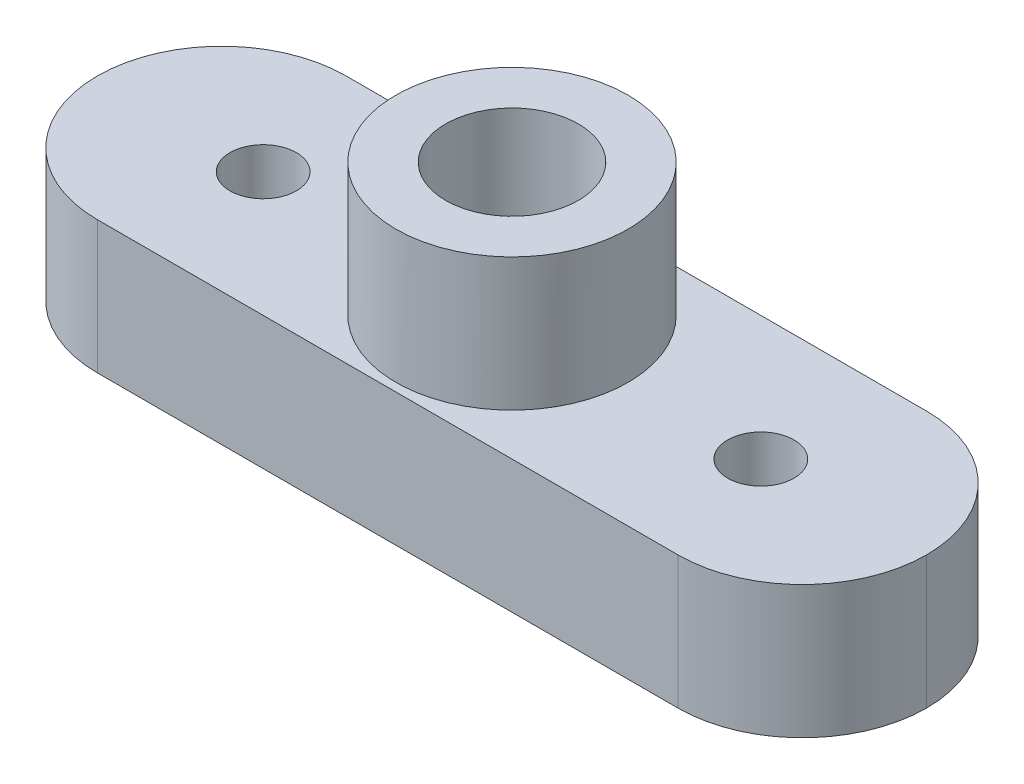
from build123d import *

# Parameters (mm, degrees)
BOSS_EXTRU_1_DEPTH      = 8
CONG_1_R                = 7.5
ENL_V_MAT_EXTRU_1_REACH = 29.299
ESQUISSE2_R             = 2
ESQUISSE3_R             = 7
ESQUISSE3_R_2           = 4
BOSS_EXTRU_2_DEPTH      = 8


with BuildPart() as part:
    # Esquisse1 → Boss.-Extru.1 (new body)
    with BuildSketch(Plane(origin=(0, 0, 0), x_dir=(1, 0, 0), z_dir=(0, 1, 0))):
        Polygon((0, -7.5), (25, -7.5), (25, 7.5), (0, 7.5), (-25, 7.5), (-25, -7.5), align=None)
    extrude(amount=BOSS_EXTRU_1_DEPTH)

    # Congé1
    cong_1_edges = [part.edges().sort_by_distance(p)[0] for p in [
        (-25, 4, 7.5),
        (-25, 4, -7.5),
        (25, 4, -7.5),
        (25, 4, 7.5),
    ]]
    fillet(cong_1_edges, radius=CONG_1_R - 0.0001)  # a hair under: the kernel refuses the full size

    # Esquisse2 → Enlèv. mat.-Extru.1 (cut, up to next)
    with BuildSketch(Plane(origin=(0, 8, 0), x_dir=(1, 0, 0), z_dir=(0, 1, 0)), mode=Mode.PRIVATE) as enl_v_mat_extru_1_sk1:
        with Locations(Location((-15, 0, 0), (0, 0, 270))):
            Circle(ESQUISSE2_R)
    enl_v_mat_extru_1_tool1 = extrude(enl_v_mat_extru_1_sk1.sketch, amount=-ENL_V_MAT_EXTRU_1_REACH, mode=Mode.PRIVATE) & part.part
    # Esquisse2 → Enlèv. mat.-Extru.1 (cut, up to next)
    with BuildSketch(Plane(origin=(0, 8, 0), x_dir=(1, 0, 0), z_dir=(0, 1, 0)), mode=Mode.PRIVATE) as enl_v_mat_extru_1_sk2:
        with Locations(Location((15, 0, 0), (0, 0, 270))):
            Circle(ESQUISSE2_R)
    enl_v_mat_extru_1_tool2 = extrude(enl_v_mat_extru_1_sk2.sketch, amount=-ENL_V_MAT_EXTRU_1_REACH, mode=Mode.PRIVATE) & part.part
    add(enl_v_mat_extru_1_tool1.solids().sort_by_distance((-15, 8, 0))[0], mode=Mode.SUBTRACT)
    add(enl_v_mat_extru_1_tool2.solids().sort_by_distance((15, 8, 0))[0], mode=Mode.SUBTRACT)

    # Esquisse3 → Boss.-Extru.2 (add)
    with BuildSketch(Plane(origin=(0, 8, 0), x_dir=(1, 0, 0), z_dir=(0, 1, 0))):
        with Locations(Location((0, 0, 0), (0, 0, 90))):
            Circle(ESQUISSE3_R)
        with Locations(Location((0, 0, 0), (0, 0, 270))):
            Circle(ESQUISSE3_R_2, mode=Mode.SUBTRACT)
    extrude(amount=BOSS_EXTRU_2_DEPTH)


solid = part.part
